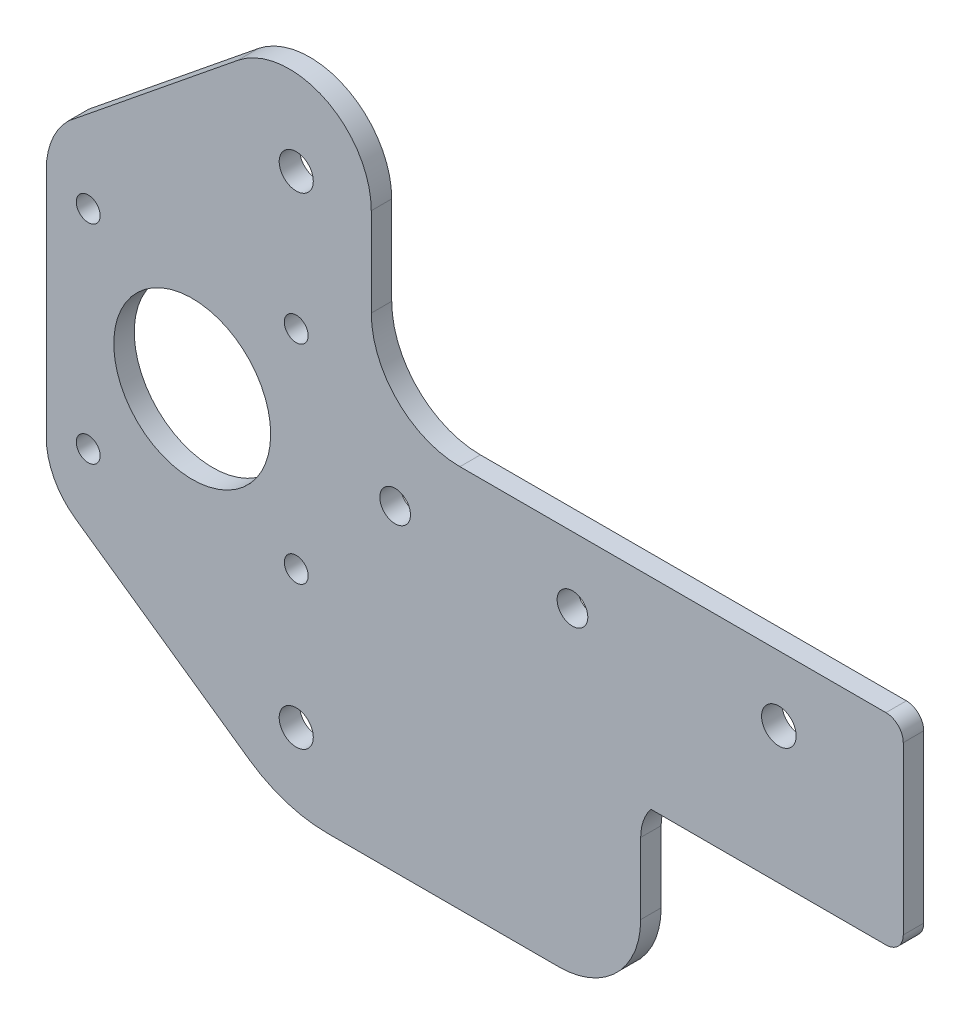
from build123d import *

# Parameters (mm, degrees)
SKETCH1_R           = 2.54
SKETCH1_R_2         = 2.25
SKETCH1_R_3         = 1.75
SKETCH1_R_4         = 2.5
SKETCH1_R_5         = 11.5
BOSS_EXTRUDE1_DEPTH = 3
FILLET2_R           = 2.54


with BuildPart() as part:
    # Sketch1 → Boss-Extrude1 (new body)
    with BuildSketch(Plane.XY):
        with BuildLine():
            Line((0, 0), (0, -29.5))
            Line((0, -29.5), (-37, -29.5))
            ThreePointArc((-37, -29.5), (-38.114378278, -31.538839171), (-38.5, -33.830127019))
            Line((-38.5, -33.830127019), (-38.5, -44.26209895))
            ThreePointArc((-38.5, -44.26209895), (-42.014718626, -52.747380324), (-50.5, -56.26209895))
            Line((-50.5, -56.26209895), (-84.414235636, -56.26209895))
            ThreePointArc((-84.414235636, -56.26209895), (-90.428351627, -55.336437965), (-95.885764364, -52.645139836))
            Line((-95.885764364, -52.645139836), (-121.385764364, -34.789847611))
            ThreePointArc((-121.385764364, -34.789847611), (-124.520108332, -31.215813301), (-125.65, -26.598327168))
            Line((-125.65, -26.598327168), (-125.65, 7.401672832))
            ThreePointArc((-125.65, 7.401672832), (-124.8106021, 11.616191188), (-122.420515459, 15.187499024))
            Line((-122.420515459, 15.187499024), (-97.551844693, 35.325751537))
            ThreePointArc((-97.551844693, 35.325751537), (-84.833866838, 36.831023412), (-78, 26))
            Line((-78, 26), (-78, 13))
            ThreePointArc((-78, 13), (-74.192388155, 3.807611845), (-65, 0))
            Line((-65, 0), (0, 0))
        make_face()
        with Locations((-18.237, -9.552)):
            Circle(SKETCH1_R, mode=Mode.SUBTRACT)
        with Locations((-48.5, -9.75)):
            Circle(SKETCH1_R_2, mode=Mode.SUBTRACT)
        with Locations((-74.5, -9.75)):
            Circle(SKETCH1_R_2, mode=Mode.SUBTRACT)
        with Locations((-89, 5.5)):
            Circle(SKETCH1_R_3, mode=Mode.SUBTRACT)
        with Locations((-89, 25.5)):
            Circle(SKETCH1_R_4, mode=Mode.SUBTRACT)
        with Locations((-89, -25)):
            Circle(SKETCH1_R_3, mode=Mode.SUBTRACT)
        with Locations((-89, -45.112)):
            Circle(SKETCH1_R_4, mode=Mode.SUBTRACT)
        with Locations((-104.25, -9.75)):
            Circle(SKETCH1_R_5, mode=Mode.SUBTRACT)
        with Locations((-119.5, 5.5)):
            Circle(SKETCH1_R_3, mode=Mode.SUBTRACT)
        with Locations((-119.5, -25)):
            Circle(SKETCH1_R_3, mode=Mode.SUBTRACT)
    extrude(amount=BOSS_EXTRUDE1_DEPTH)

    # Fillet2
    fillet2_edges = [part.edges().sort_by_distance(p)[0] for p in [
        (0, 0, 1.5),
        (0, -29.5, 1.5),
    ]]
    fillet(fillet2_edges, radius=FILLET2_R)


solid = part.part
